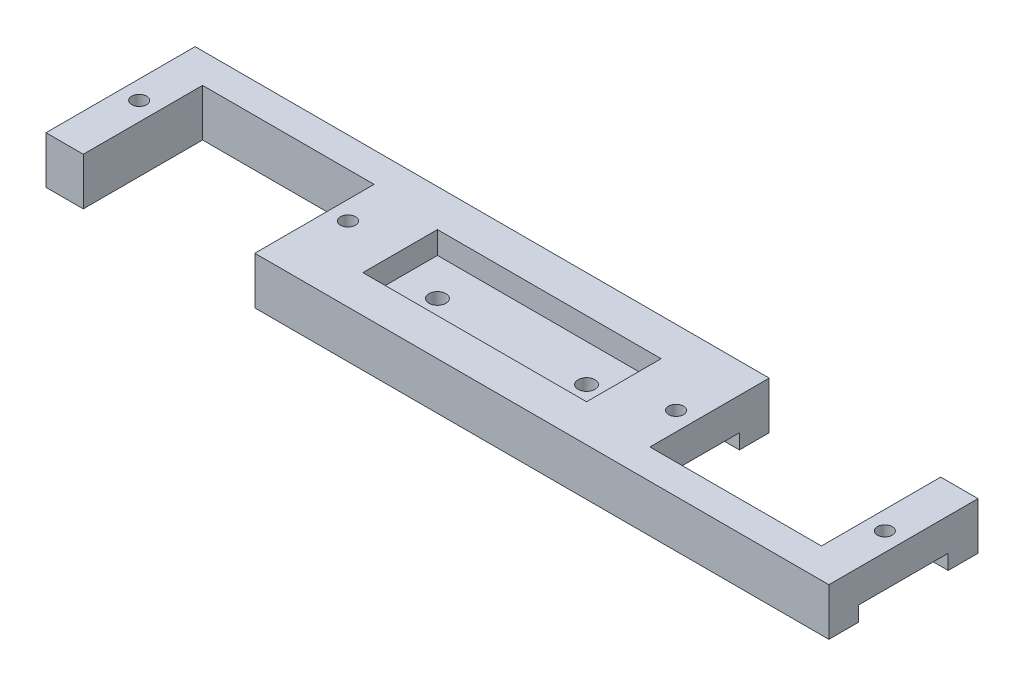
from build123d import *

# Parameters (mm, degrees)
SKETCH1_W                      = 105
SKETCH1_H                      = 20
BOSS_EXTRUDE1_DEPTH            = 6.35
SKETCH3_W                      = 23
SKETCH3_H                      = 16
CUT_EXTRUDE1_DEPTH             = 54.819815124
SKETCH4_W                      = 5
SKETCH4_H                      = 12
CUT_EXTRUDE2_DEPTH             = 2
M2_CLEARANCE_HOLE1_D           = 2
SKETCH9_W                      = 30
SKETCH9_H                      = 10
CUT_EXTRUDE3_DEPTH             = 3
F_2_CLEARANCE_HOLE1_AT_2_COUNT = 2
F_2_CLEARANCE_HOLE1_AT_2_PITCH = 20


with BuildPart() as part:
    # Sketch1 → Boss-Extrude1 (new body)
    with BuildSketch(Plane(origin=(0, 0, 0), x_dir=(1, 0, 0), z_dir=(0, 1, 0))):
        Rectangle(SKETCH1_W, SKETCH1_H)
    extrude(amount=BOSS_EXTRUDE1_DEPTH)

    # Sketch3 → Cut-Extrude1 (cut, through all)
    with BuildSketch(Plane(origin=(0, 6.35, 0), x_dir=(1, 0, 0), z_dir=(0, 1, 0))):
        with Locations((-36, -2)):
            Rectangle(SKETCH3_W, SKETCH3_H)
        with Locations((36, 2)):
            Rectangle(SKETCH3_W, SKETCH3_H)
    extrude(amount=-CUT_EXTRUDE1_DEPTH, mode=Mode.SUBTRACT)

    # Sketch4 → Cut-Extrude2 (cut)
    with BuildSketch(Plane.XZ):
        with Locations((22, 0)):
            Rectangle(SKETCH4_W, SKETCH4_H)
        with Locations((50, 0)):
            Rectangle(SKETCH4_W, SKETCH4_H)
    extrude(amount=-CUT_EXTRUDE2_DEPTH, mode=Mode.SUBTRACT)

    # M2 Clearance Hole1 (through all)
    with Locations(Plane(origin=(0, 6.35, 0), x_dir=(1, 0, 0), z_dir=(0, 1, 0))):
        with Locations((50, 0), (-50, 0), (-22, 0), (22, 0)):
            Hole(M2_CLEARANCE_HOLE1_D / 2)

    # Sketch9 → Cut-Extrude3 (cut)
    with BuildSketch(Plane(origin=(0, 6.35, 0), x_dir=(1, 0, 0), z_dir=(0, 1, 0))):
        Rectangle(SKETCH9_W, SKETCH9_H)
    extrude(amount=-CUT_EXTRUDE3_DEPTH, mode=Mode.SUBTRACT)

    # Sketch14 → #2 Clearance Hole1 (revolve, cut)
    with BuildSketch(Plane(origin=(-10, 3.35, 0), x_dir=(0, 0, 1), z_dir=(1, 0, 0))):
        Polygon((0, 0), (0, 3.35), (2.032, 3.35), (1.1303, 2.365967125), (1.1303, 0), align=None)
    f_2_clearance_hole1 = revolve(axis=Axis((-10, 9.7, 0), (0, -1, 0)), mode=Mode.SUBTRACT)

    # #2 Clearance Hole1 at 2: #2 Clearance Hole1 ×2
    with Locations(*[(i * F_2_CLEARANCE_HOLE1_AT_2_PITCH, 0, 0) for i in range(1, F_2_CLEARANCE_HOLE1_AT_2_COUNT)]):
        add(f_2_clearance_hole1, mode=Mode.SUBTRACT)


solid = part.part
